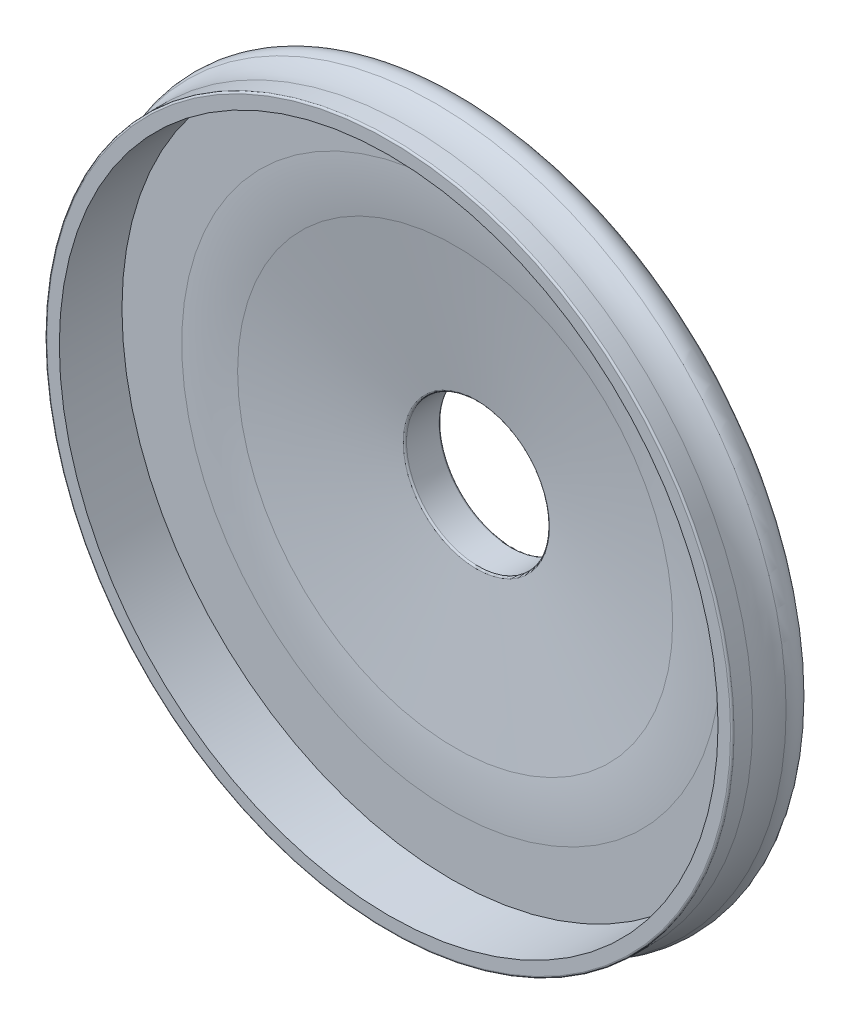
from build123d import *

# Parameters (mm, degrees)
SKETCH1_R           = 9.6
SKETCH1_R_2         = 9.2
EXTRUDE_THIN1_DEPTH = 1.5
SKETCH5_R           = 2
CUT_EXTRUDE1_DEPTH  = 10
FILLET1_R           = 1.6
CUT_EXTRUDE2_START  = -0.25
SKETCH6_R           = 9.2
CUT_EXTRUDE2_DEPTH  = 0.25
FILLET3_R           = 10
FILLET4_R           = 0.5
FILLET5_R           = 0.05
FILLET6_R           = 0.05


with BuildPart() as part:
    # Sketch1 → Extrude-Thin1 (new body)
    with BuildSketch(Plane(origin=(0, 0, 0), x_dir=(0, 1, 0), z_dir=(0, 0, 1))):
        Circle(SKETCH1_R)
        Circle(SKETCH1_R_2, mode=Mode.SUBTRACT)
    extrude(amount=EXTRUDE_THIN1_DEPTH)

    # Sketch4 → Revolve1 (revolve)
    with BuildSketch(Plane.YZ, mode=Mode.PRIVATE) as revolve1_sk:
        with BuildLine():
            Line((0, -1.25), (0, -2))
            add(Edge.make_bspline(
                [(0, -2), (9.9, -2), (9.9, 0)],
                knots=[4.71238898, 4.71238898, 4.71238898, 6.283185307, 6.283185307, 6.283185307], degree=2, weights=[1, 0.707106781, 1]))
            Line((9.9, 0), (8.5, 0))
            Line((8.5, 0), (0, -1.25))
        make_face()
    revolve(revolve1_sk.sketch.rotate(Axis((0, 0, 0), (0, 0, -1)), 90), axis=Axis((0, 0, 0), (0, 0, -1)))

    # Sketch5 → Cut-Extrude1 (cut)
    with BuildSketch(Plane.XY.offset(1.5)):
        Circle(SKETCH5_R)
    extrude(amount=-CUT_EXTRUDE1_DEPTH, mode=Mode.SUBTRACT)

    # Fillet1
    # the kernel refuses this fillet: 1.6 mm, written as the material it adds along each edge
    with BuildSketch(Plane(origin=(0, 0, 0), x_dir=(0, 1, 0), z_dir=(1, 0, 0))) as fillet1_piece_1:
        with BuildLine():
            CenterArc((11.2, 0.932737905), FILLET1_R, 180, 35.659087696)
            Line((9.6, 0.932737905), (9.568, 0.932737905))
            Line((9.568, 0.932737905), (9.568, 0))
            Line((9.568, 0), (9.6, -0.032))
            ThreePointArc((9.6, -0.032), (9.75, -0.032), (9.874, -0.018654758))
            Line((9.874, -0.018654758), (9.9, 0))
        make_face()
    revolve(axis=Axis((0, 0, 0), (0, 0, 1)))

    # Sketch6 → Cut-Extrude2 (cut)
    with BuildSketch(Plane(origin=(0, 0, 0), x_dir=(0, 1, 0), z_dir=(0, 0, 1)).offset(CUT_EXTRUDE2_START)):
        with Locations(Location((0, 0, 0), (0, 0, 270))):
            Circle(SKETCH6_R)
    extrude(amount=CUT_EXTRUDE2_DEPTH, mode=Mode.SUBTRACT)

    # Fillet3
    fillet3_edges = [part.edges().sort_by_distance(p)[0] for p in [
        (-6.8, 0, -0.25),
    ]]
    fillet(fillet3_edges, radius=FILLET3_R)

    # Fillet4
    # the kernel refuses this fillet: 0.5 mm, written as the material it takes off along each edge
    with BuildSketch(Plane(origin=(0, 0, 0), x_dir=(1, 0, 0), z_dir=(0, 1, 0))) as fillet4_piece_1:
        with BuildLine():
            CenterArc((9.343669863, 0.049116678), FILLET4_R, 332.124633973, 73.777653)
            Line((9.785653229, -0.184658223), (9.794492896, -0.189333721))
            ThreePointArc((9.794492896, -0.189333721), (9.848191584, -0.095651287), (9.908125, -0.005829612))
            Line((9.908125, -0.005829612), (9.91, 0))
            ThreePointArc((9.91, 0), (9.844806059, 0.231789199), (9.69857077, 0.415375256))
            Line((9.69857077, 0.415375256), (9.691611929, 0.408193715))
        make_face()
    revolve(axis=Axis((0, 0, 0), (0, 0, -1)), revolution_arc=270, mode=Mode.SUBTRACT)
    with BuildSketch(Plane(origin=(0, 0, 0), x_dir=(0, 1, 0), z_dir=(-1, 0, 0))) as fillet4_piece_2:
        with BuildLine():
            CenterArc((9.343669863, 0.049116678), FILLET4_R, 332.124633973, 73.777653)
            Line((9.785653229, -0.184658223), (9.794492896, -0.189333721))
            ThreePointArc((9.794492896, -0.189333721), (9.848191584, -0.095651287), (9.908125, -0.005829612))
            Line((9.908125, -0.005829612), (9.91, 0))
            ThreePointArc((9.91, 0), (9.844806059, 0.231789199), (9.69857077, 0.415375256))
            Line((9.69857077, 0.415375256), (9.691611929, 0.408193715))
        make_face()
    revolve(axis=Axis((0, 0, 0), (0, 0, -1)), revolution_arc=90, mode=Mode.SUBTRACT)

    # Fillet5
    fillet5_edges = [part.edges().sort_by_distance(p)[0] for p in [
        (-1.999999999, 1e-09, -1.958762709),
        (-2, 0, -0.955882353),
    ]]
    fillet(fillet5_edges, radius=FILLET5_R)

    # Fillet6
    fillet6_edges = [part.edges().sort_by_distance(p)[0] for p in [
        (0, -9.6, 1.5),
    ]]
    fillet(fillet6_edges, radius=FILLET6_R)


solid = part.part
